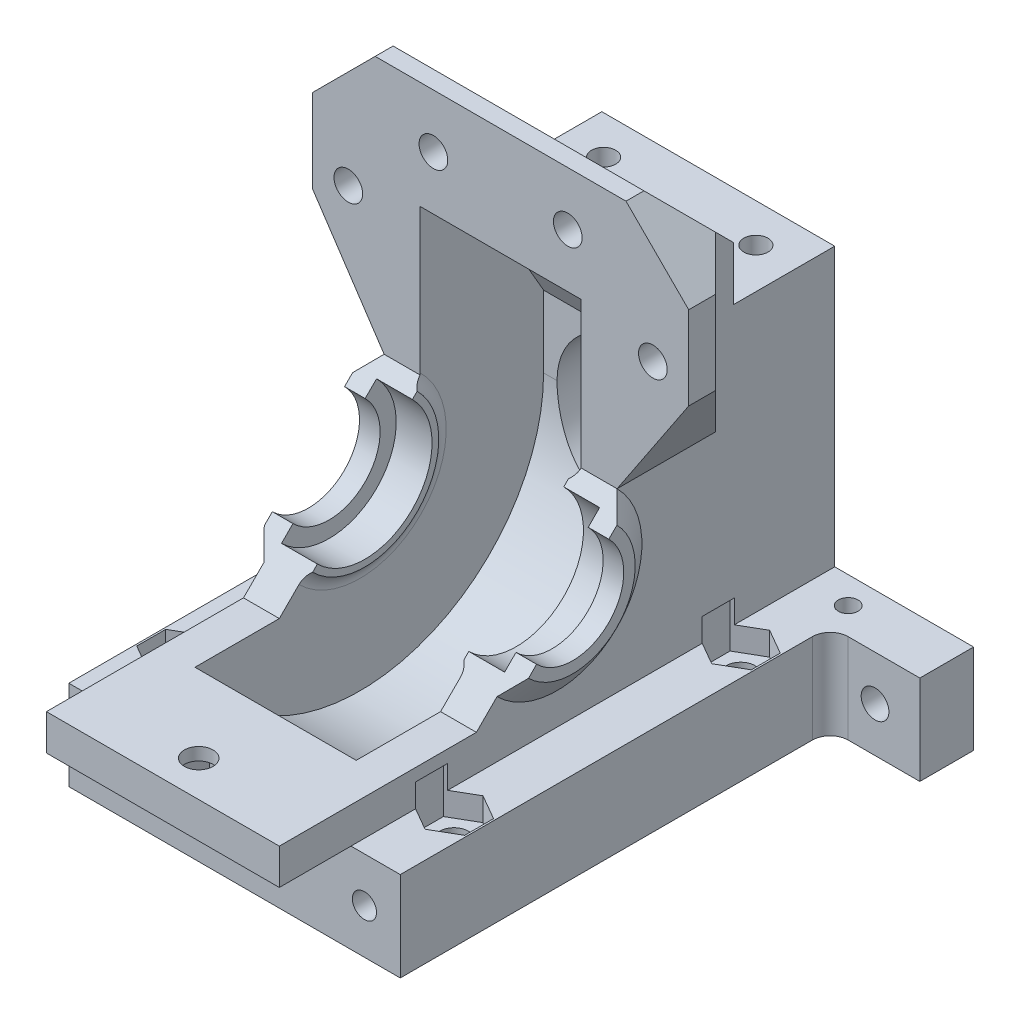
from build123d import *

# Parameters (mm, degrees)
ESQUISSE1_R                          = 1.1
ESQUISSE1_R_2                        = 1.6
BOSS_EXTRU_1_DEPTH                   = 10
BOSS_EXTRU_2_DEPTH                   = 13
BOSS_EXTRU_2_DEPTH_BACK              = 13
BOSS_EXTRU_3_DEPTH                   = 1.75
BOSS_EXTRU_7_DEPTH                   = 11
CHANFREIN2_SIZE                      = 8
ESQUISSE6_R                          = 1.6
ESQUISSE6_R_2                        = 1.55
ENL_V_MAT_EXTRU_3_DEPTH              = 52
ENL_V_MAT_EXTRU_17_DEPTH             = 21.3
ESQUISSE31_R                         = 1.35
ENL_V_MAT_EXTRU_16_DEPTH             = 10
ENL_V_MAT_EXTRU_5_DEPTH              = 2.6
ESQUISSE13_R                         = 1.35
ENL_V_MAT_EXTRU_6_DEPTH              = 8
ENL_V_MAT_EXTRU_7_DEPTH              = 9
ENL_V_MAT_EXTRU_7_DEPTH_BACK         = 9
BOSS_EXTRU_5_REACH                   = 61.593
ENL_V_MAT_EXTRU_8_DEPTH              = 4
CONG_1_R                             = 2
ENL_V_MAT_EXTRU_10_REACH             = 65.853
ESQUISSE21_R                         = 1.6
ENL_V_MAT_EXTRU_11_DEPTH             = 2.6
ESQUISSE30_R                         = 6
ESQUISSE30_R_2                       = 3.5
BOSS_EXTRU_6_DEPTH                   = 3.5
CONG_2_R                             = 3.5
ENL_V_MAT_EXTRU_12_REACH             = 78.689
ESQUISSE25_R                         = 5.1
ENL_V_MAT_EXTRU_12_DIRECTION_2_DEPTH = 2.5
ESQUISSE26_R                         = 7.5
ENL_V_MAT_EXTRU_13_DEPTH             = 5
ENL_V_MAT_EXTRU_13_DIRECTION_2_REACH = 70.48
CHANFREIN3_SIZE2                     = 2.5
CHANFREIN3_SIZE                      = 1.75
CHANFREIN4_SIZE2                     = 1.75
CHANFREIN4_SIZE                      = 2.5
CHANFREIN5_SIZE                      = 10


# Some blends are built 0.0001 mm under size
with BuildPart() as part:
    # Esquisse1 → Boss.-Extru.1 (new body)
    with BuildSketch(Plane(origin=(0, -23, 0), x_dir=(1, 0, 0), z_dir=(0, 1, 0))):
        Polygon((18.5, -23), (-18.5, -23), (-18.5, 25), (-28.5, 25), (-28.5, 31), (28.5, 31), (28.5, 25), (18.5, 25), align=None)
        with Locations(Location((-17.5, 28, 0), (0, 0, 270))):
            Circle(ESQUISSE1_R, mode=Mode.SUBTRACT)
        with Locations(Location((-15.5, 18, 0), (0, 0, 270))):
            Circle(ESQUISSE1_R_2, mode=Mode.SUBTRACT)
        with Locations(Location((-15.5, -14, 0), (0, 0, 270))):
            Circle(ESQUISSE1_R_2, mode=Mode.SUBTRACT)
        with Locations(Location((15.5, -14, 0), (0, 0, 90))):
            Circle(ESQUISSE1_R_2, mode=Mode.SUBTRACT)
        with Locations(Location((15.5, 18, 0), (0, 0, 90))):
            Circle(ESQUISSE1_R_2, mode=Mode.SUBTRACT)
        with Locations(Location((17.5, 28, 0), (0, 0, 90))):
            Circle(ESQUISSE1_R, mode=Mode.SUBTRACT)
    extrude(amount=BOSS_EXTRU_1_DEPTH)

    # Esquisse2 → Boss.-Extru.2 (add, two sides: drawn at the far end of the back side and taken through both)
    with BuildSketch(Plane(origin=(0, 0, 0), x_dir=(0, 0, -1), z_dir=(1, 0, 0)).offset(-BOSS_EXTRU_2_DEPTH_BACK)):
        with BuildLine():
            Line((31, -13), (-31, -13))
            Line((-31, -13), (-31, -9))
            Line((-31, -9), (-9, -9))
            Line((-9, -9), (-4.030508653, -4.030508653))
            ThreePointArc((-4.030508653, -4.030508653), (4.030508653, -4.030508653), (4.030508653, 4.030508653))
            Line((4.030508653, 4.030508653), (6.7, 6.7))
            Line((6.7, 6.7), (6.7, 35))
            Line((6.7, 35), (8.7, 35))
            Line((8.7, 35), (19.7, 24))
            Line((19.7, 24), (19.7, 18))
            Line((19.7, 18), (31, 18))
            Line((31, 18), (31, -13))
        make_face()
    extrude(amount=BOSS_EXTRU_2_DEPTH + BOSS_EXTRU_2_DEPTH_BACK)

    # Esquisse3 → Boss.-Extru.3 (add)
    with BuildSketch(Plane(origin=(13, 0, 0), x_dir=(0, 0, -1), z_dir=(1, 0, 0))):
        with BuildLine():
            Line((-6.7, -6.7), (-4.030508653, -4.030508653))
            ThreePointArc((-4.030508653, -4.030508653), (4.030508653, -4.030508653), (4.030508653, 4.030508653))
            Line((4.030508653, 4.030508653), (6.7, 6.7))
            ThreePointArc((6.7, 6.7), (6.7, -6.7), (-6.7, -6.7))
        make_face()
    boss_extru_3 = extrude(amount=BOSS_EXTRU_3_DEPTH)

    # Esquisse4 → Boss.-Extru.7 (add)
    with BuildSketch(Plane(origin=(19.7, 0, -6.7), x_dir=(-1, 0, 0), z_dir=(0, 0, -1))):
        Polygon((6.7, 6.7), (-1.3, 18.7), (-1.3, 26), (6.7, 26), align=None)
        Polygon((40.7, 18.7), (40.7, 26), (32.7, 26), (32.7, 6.7), align=None)
    extrude(amount=BOSS_EXTRU_7_DEPTH)

    # Chanfrein2
    chanfrein2_edges = [part.edges().sort_by_distance(p)[0] for p in [
        (-21, 22.35, -17.7),
        (21, 22.35, -17.7),
    ]]
    chamfer(chanfrein2_edges, length=CHANFREIN2_SIZE - 0.0001)  # a hair under: the kernel refuses the full size

    # Esquisse6 → Enlèv. mat.-Extru.3 (cut)
    with BuildSketch(Plane.XY.offset(23)):
        with Locations((17, 21)):
            Circle(ESQUISSE6_R)
        with Locations((7.5, 29)):
            Circle(ESQUISSE6_R)
        with Locations((23.5, -18)):
            Circle(ESQUISSE6_R_2)
    enl_v_mat_extru_3 = extrude(amount=-ENL_V_MAT_EXTRU_3_DEPTH, mode=Mode.SUBTRACT)

    # Esquisse7 → Enlèv. mat.-Extru.17 (cut)
    with BuildSketch(Plane(origin=(0, 0, -31), x_dir=(-1, 0, 0), z_dir=(0, 0, -1))):
        Polygon((-14.2, 22.616580754), (-17, 24.233161507), (-19.8, 22.616580754), (-19.8, 19.383419246), (-17, 17.766838493), (-14.2, 19.383419246), align=None)
        Polygon((-4.266838493, 29), (-5.883419246, 31.8), (-9.116580754, 31.8), (-10.733161507, 29), (-9.116580754, 26.2), (-5.883419246, 26.2), align=None)
    enl_v_mat_extru_17 = extrude(amount=-ENL_V_MAT_EXTRU_17_DEPTH, mode=Mode.SUBTRACT)

    # Esquisse31 → Enlèv. mat.-Extru.16 (cut)
    with BuildSketch(Plane.XY.offset(23)):
        with Locations((14.5, -18)):
            Circle(ESQUISSE31_R)
        with Locations(Location((-14.5, -18, 0), (0, 0, 280.628726743))):
            Circle(ESQUISSE31_R)
    enl_v_mat_extru_16 = extrude(amount=-ENL_V_MAT_EXTRU_16_DEPTH, mode=Mode.SUBTRACT)

    # Esquisse9 → Enlèv. mat.-Extru.5 (cut, symmetric)
    with BuildSketch(Plane(origin=(0, -13, 0), x_dir=(1, 0, 0), z_dir=(0, 1, 0))):
        Polygon((18.3, -15.616580754), (18.3, -12.383419246), (15.5, -10.766838493), (12.7, -12.383419246), (12.7, -15.616580754), (15.5, -17.233161507), align=None)
        Polygon((18.3, 19.616580754), (15.5, 21.233161507), (12.7, 19.616580754), (12.7, 16.383419246), (15.5, 14.766838493), (18.3, 16.383419246), align=None)
    enl_v_mat_extru_5 = extrude(amount=ENL_V_MAT_EXTRU_5_DEPTH, both=True, mode=Mode.SUBTRACT)

    # Esquisse13 → Enlèv. mat.-Extru.6 (cut)
    with BuildSketch(Plane(origin=(0, 18, 0), x_dir=(1, 0, 0), z_dir=(0, 1, 0))):
        with Locations(Location((8.5, 26.7, 0), (0, 0, 270))):
            Circle(ESQUISSE13_R)
    enl_v_mat_extru_6 = extrude(amount=-ENL_V_MAT_EXTRU_6_DEPTH, mode=Mode.SUBTRACT)

    # Esquisse14 → Enlèv. mat.-Extru.7 (cut, two sides: drawn at the far end of the back side and taken through both)
    with BuildSketch(Plane(origin=(0, 0, 0), x_dir=(0, 0, -1), z_dir=(1, 0, 0)).offset(-ENL_V_MAT_EXTRU_7_DEPTH_BACK)):
        with BuildLine():
            Line((20.5, 0), (20.5, 8))
            Line((20.5, 8), (13.57179677, 20))
            Line((13.57179677, 20), (6.7, 23))
            Line((6.7, 23), (6.7, 6.7))
            Line((6.7, 6.7), (4.030508653, 4.030508653))
            ThreePointArc((4.030508653, 4.030508653), (4.030508653, -4.030508653), (-4.030508653, -4.030508653))
            Line((-4.030508653, -4.030508653), (-9, -9))
            Line((-9, -9), (-18.418740456, -9))
            ThreePointArc((-18.418740456, -9), (4.618756361, -19.972908894), (20.5, 0))
        make_face()
    extrude(amount=ENL_V_MAT_EXTRU_7_DEPTH + ENL_V_MAT_EXTRU_7_DEPTH_BACK, mode=Mode.SUBTRACT)

    # Esquisse17 → Boss.-Extru.5 (add, up to next)
    with BuildSketch(Plane(origin=(8.45, 0, 0), x_dir=(0, 0, -1), z_dir=(1, 0, 0)), mode=Mode.PRIVATE) as boss_extru_5_sk1:
        with BuildLine():
            Line((4.030508653, 4.030508653), (5.833630945, 5.833630945))
            ThreePointArc((5.833630945, 5.833630945), (5.833630945, -5.833630945), (-5.833630945, -5.833630945))
            Line((-5.833630945, -5.833630945), (-4.030508653, -4.030508653))
            ThreePointArc((-4.030508653, -4.030508653), (4.030508653, -4.030508653), (4.030508653, 4.030508653))
        make_face()
    boss_extru_5_tool1 = extrude(boss_extru_5_sk1.sketch, amount=BOSS_EXTRU_5_REACH, mode=Mode.PRIVATE) - part.part
    boss_extru_5 = boss_extru_5_tool1.solids().sort_by_distance((8.45, -5.072906, 4.791233))[0]
    add(boss_extru_5)

    # Esquisse18 → Enlèv. mat.-Extru.8 (cut)
    with BuildSketch(Plane.ZY.offset(-8.45)):
        with BuildLine():
            Line((-5.303300859, 5.303300859), (5.303300859, -5.303300859))
            ThreePointArc((5.303300859, -5.303300859), (-5.303300859, -5.303300859), (-5.303300859, 5.303300859))
        make_face()
    enl_v_mat_extru_8 = extrude(amount=-ENL_V_MAT_EXTRU_8_DEPTH, mode=Mode.SUBTRACT)

    # Symétrie1: Boss.-Extru.3, Enlèv. mat.-Extru.3, Enlèv. mat.-Extru.17, Enlèv. mat.-Extru.16, Enlèv. mat.-Extru.5, Enlèv. mat.-Extru.6, Boss.-Extru.5, Enlèv. mat.-Extru.8 across plane
    add(boss_extru_3.mirror(Plane(origin=(0, 0, 0), x_dir=(0, 0, 1), z_dir=(1, 0, 0))))
    add(enl_v_mat_extru_3.mirror(Plane(origin=(0, 0, 0), x_dir=(0, 0, 1), z_dir=(1, 0, 0))), mode=Mode.SUBTRACT)
    add(enl_v_mat_extru_17.mirror(Plane(origin=(0, 0, 0), x_dir=(0, 0, 1), z_dir=(1, 0, 0))), mode=Mode.SUBTRACT)
    add(enl_v_mat_extru_16.mirror(Plane(origin=(0, 0, 0), x_dir=(0, 0, 1), z_dir=(1, 0, 0))), mode=Mode.SUBTRACT)
    add(enl_v_mat_extru_5.mirror(Plane(origin=(0, 0, 0), x_dir=(0, 0, 1), z_dir=(1, 0, 0))), mode=Mode.SUBTRACT)
    add(enl_v_mat_extru_6.mirror(Plane(origin=(0, 0, 0), x_dir=(0, 0, 1), z_dir=(1, 0, 0))), mode=Mode.SUBTRACT)
    add(boss_extru_5.mirror(Plane(origin=(0, 0, 0), x_dir=(0, 0, 1), z_dir=(1, 0, 0))))
    add(enl_v_mat_extru_8.mirror(Plane(origin=(0, 0, 0), x_dir=(0, 0, 1), z_dir=(1, 0, 0))), mode=Mode.SUBTRACT)

    # Congé1
    # the kernel refuses this fillet: 2 mm, written as the material it adds along each edge
    with BuildSketch(Plane(origin=(9, 0, 0), x_dir=(0, 0.7071067811865466, -0.7071067811865485), z_dir=(0, 0.7071067811865485, 0.7071067811865466))) as cong_1_piece_1:
        with BuildLine():
            CenterArc((9.627497731, 2), CONG_1_R, 226.468847833, 43.531152167)
            Line((8.25, 0.55), (8.25, 0))
            Line((8.25, 0), (9.627497731, 0))
        make_face()
    revolve(axis=Axis((9, 0, 0), (-1, 0, 0)), revolution_arc=180)
    with BuildSketch(Plane(origin=(9, 0, 0), x_dir=(0, 0.9332991182686485, -0.3590999245877991), z_dir=(0, 0.3590999245877991, 0.9332991182686485))) as cong_1_piece_2_section:
        with BuildLine():
            CenterArc((9.627497731, 2), CONG_1_R, 226.468847833, 43.531152167)
            Line((8.25, 0.55), (8.25, 0))
            Line((8.25, 0), (9.627497731, 0))
        make_face()
    cong_1_piece_2 = revolve(axis=Axis((9, 0, 0), (-1, 0, 0)), revolution_arc=227.910140794, mode=Mode.PRIVATE)
    cong_1_piece_2 = split(cong_1_piece_2, bisect_by=Plane(origin=(8.998948002, 6.806570833, -6.7), z_dir=(0, 0, -1)), keep=Keep.TOP, mode=Mode.PRIVATE)
    add(cong_1_piece_2)
    with BuildSketch(Plane(origin=(-9, 0, 0), x_dir=(0, 0.7071067811865466, -0.7071067811865485), z_dir=(0, 0.7071067811865485, 0.7071067811865466))) as cong_1_piece_3:
        with BuildLine():
            CenterArc((9.627497731, -2), CONG_1_R, 90, 43.531152167)
            Line((8.25, -0.55), (8.25, 0))
            Line((8.25, 0), (9.627497731, 0))
        make_face()
    revolve(axis=Axis((-9, 0, 0), (-1, 0, 0)), revolution_arc=180)
    with BuildSketch(Plane(origin=(-9, 0, 0), x_dir=(0, 0.9332991182686485, -0.3590999245877991), z_dir=(0, 0.3590999245877991, 0.9332991182686485))) as cong_1_piece_4_section:
        with BuildLine():
            CenterArc((9.627497731, -2), CONG_1_R, 90, 43.531152167)
            Line((8.25, -0.55), (8.25, 0))
            Line((8.25, 0), (9.627497731, 0))
        make_face()
    cong_1_piece_4 = revolve(axis=Axis((-9, 0, 0), (-1, 0, 0)), revolution_arc=227.910140794, mode=Mode.PRIVATE)
    cong_1_piece_4 = split(cong_1_piece_4, bisect_by=Plane(origin=(-8.998948002, 6.806570833, -6.7), z_dir=(0, 0, -1)), keep=Keep.TOP, mode=Mode.PRIVATE)
    add(cong_1_piece_4)
    with BuildSketch(Plane(origin=(18.5, -23, -25), x_dir=(1, 0, 0), z_dir=(0, 1, 0)), Plane(origin=(-18.5, -23, -25), x_dir=(0, 0, 1), z_dir=(0, 1, 0))) as cong_1_piece_5:
        with BuildLine():
            CenterArc((CONG_1_R, -CONG_1_R), CONG_1_R, 90, 90)
            Line((0, -CONG_1_R), (0, 0))
            Line((0, 0), (CONG_1_R, 0))
        make_face()
    extrude(amount=10)

    # Esquisse21 → Enlèv. mat.-Extru.10 (cut, up to next)
    with BuildSketch(Plane.XZ.offset(13), mode=Mode.PRIVATE) as enl_v_mat_extru_10_sk1:
        with Locations(Location((0, 27, 0), (0, 0, 270))):
            Circle(ESQUISSE21_R)
    enl_v_mat_extru_10_tool1 = extrude(enl_v_mat_extru_10_sk1.sketch, amount=-ENL_V_MAT_EXTRU_10_REACH, mode=Mode.PRIVATE) & part.part
    add(enl_v_mat_extru_10_tool1.solids().sort_by_distance((0, -13, 27))[0], mode=Mode.SUBTRACT)

    # Esquisse22 → Enlèv. mat.-Extru.11 (cut)
    with BuildSketch(Plane.XZ.offset(13)):
        Polygon((3.233161507, 27), (1.616580754, 29.8), (-1.616580754, 29.8), (-3.233161507, 27), (-1.616580754, 24.2), (1.616580754, 24.2), align=None)
    extrude(amount=-ENL_V_MAT_EXTRU_11_DEPTH, mode=Mode.SUBTRACT)

    # Esquisse30 → Boss.-Extru.6 (add)
    with BuildSketch(Plane(origin=(0, 0, -31), x_dir=(-1, 0, 0), z_dir=(0, 0, -1))):
        with Locations(Location((0, 0, 0), (0, 0, 180))):
            Circle(ESQUISSE30_R)
        Circle(ESQUISSE30_R_2, mode=Mode.SUBTRACT)
    extrude(amount=BOSS_EXTRU_6_DEPTH)

    # Congé2
    cong_2_edges = [part.edges().sort_by_distance(p)[0] for p in [
        (-6, 0, -31),
    ]]
    fillet(cong_2_edges, radius=CONG_2_R - 0.0001)  # a hair under: the kernel refuses the full size

    # Esquisse25 → Enlèv. mat.-Extru.12 (cut, up to next)
    with BuildSketch(Plane(origin=(0, 0, -31), x_dir=(-1, 0, 0), z_dir=(0, 0, -1)), mode=Mode.PRIVATE) as enl_v_mat_extru_12_sk1:
        Circle(ESQUISSE25_R)
    enl_v_mat_extru_12_tool1 = extrude(enl_v_mat_extru_12_sk1.sketch, amount=-ENL_V_MAT_EXTRU_12_REACH, mode=Mode.PRIVATE) & part.part
    add(enl_v_mat_extru_12_tool1.solids().sort_by_distance((0, 0, -31))[0], mode=Mode.SUBTRACT)

    # Esquisse25 → Enlèv. mat.-Extru.12 direction 2 (cut)
    with BuildSketch(Plane(origin=(0, 0, -31), x_dir=(-1, 0, 0), z_dir=(0, 0, -1))):
        Circle(ESQUISSE25_R)
    extrude(amount=ENL_V_MAT_EXTRU_12_DIRECTION_2_DEPTH, mode=Mode.SUBTRACT)

    # Esquisse26 → Enlèv. mat.-Extru.13 (cut)
    with BuildSketch(Plane.XY.offset(-20.5)):
        Circle(ESQUISSE26_R)
    extrude(amount=-ENL_V_MAT_EXTRU_13_DEPTH, mode=Mode.SUBTRACT)

    # Esquisse26 → Enlèv. mat.-Extru.13 direction 2 (cut, up to next)
    with BuildSketch(Plane.XY.offset(-20.5), mode=Mode.PRIVATE) as enl_v_mat_extru_13_direction_2_sk1:
        Circle(ESQUISSE26_R)
    enl_v_mat_extru_13_direction_2_tool1 = extrude(enl_v_mat_extru_13_direction_2_sk1.sketch, amount=ENL_V_MAT_EXTRU_13_DIRECTION_2_REACH, mode=Mode.PRIVATE) & part.part
    add(enl_v_mat_extru_13_direction_2_tool1.solids().sort_by_distance((0, 0, -20.5))[0], mode=Mode.SUBTRACT)

    # Chanfrein3
    chanfrein3_edges = [part.edges().sort_by_distance(p)[0] for p in [
        (14.75, -6.7, -6.7),
    ]]
    chanfrein3_side = [part.faces().sort_by_distance(p)[0] for p in [
        (14.715, -6.7, -6.7),
    ]]
    chamfer(chanfrein3_edges, length=CHANFREIN3_SIZE - 0.0001, length2=CHANFREIN3_SIZE2 - 0.0001, reference=chanfrein3_side[0])  # a hair under: the kernel refuses the full size

    # Chanfrein4
    chanfrein4_edges = [part.edges().sort_by_distance(p)[0] for p in [
        (-14.75, -6.7, -6.7),
    ]]
    chanfrein4_side = [part.faces().sort_by_distance(p)[0] for p in [
        (-14.75, -6.675251263, -6.675251263),
    ]]
    chamfer(chanfrein4_edges, length=CHANFREIN4_SIZE - 0.0001, length2=CHANFREIN4_SIZE2 - 0.0001, reference=chanfrein4_side[0])  # a hair under: the kernel refuses the full size

    # Chanfrein5
    # the kernel refuses this chamfer: 10 mm, written as the material it adds along each edge
    with BuildSketch(Plane(origin=(13, 26, -6.7), x_dir=(-0.027495876610586317, 0.9996219169112968, 0), z_dir=(0, 0, -1))) as chanfrein5_piece_1_section:
        Polygon((CHANFREIN5_SIZE * 0.999621916911, CHANFREIN5_SIZE * 0.0274958766106), (-CHANFREIN5_SIZE * 0.0274958766106, CHANFREIN5_SIZE * 0.999621916911), (0, 0), align=None)
    chanfrein5_piece_1 = extrude(amount=36.71682988, mode=Mode.PRIVATE)
    chanfrein5_piece_1 = split(chanfrein5_piece_1, bisect_by=Plane(origin=(15.905078953, 35, -10.088110042), z_dir=(0, -1, 0)), keep=Keep.TOP, mode=Mode.PRIVATE)
    chanfrein5_piece_1 = split(chanfrein5_piece_1, bisect_by=Plane(origin=(21, 29.004234715, -10.088110042), z_dir=(-1, 0, 0)), keep=Keep.TOP, mode=Mode.PRIVATE)
    chanfrein5_piece_1 = split(chanfrein5_piece_1, bisect_by=Plane(origin=(15.905078953, 31.308062337, -12.391937663), z_dir=(0, -0.7071067811865492, 0.707106781186546)), keep=Keep.TOP, mode=Mode.PRIVATE)
    chanfrein5_piece_1 = split(chanfrein5_piece_1, bisect_by=Plane(origin=(18.258534456, 29.004234715, -12.441565544), z_dir=(-0.7071067811865476, 0, 0.7071067811865476)), keep=Keep.TOP, mode=Mode.PRIVATE)
    add(chanfrein5_piece_1)
    with BuildSketch(Plane(origin=(-13, 26, -6.7), x_dir=(-0.9996219169112968, -0.027495876610586317, 0), z_dir=(0, 0, -1))) as chanfrein5_piece_2_section:
        Polygon((CHANFREIN5_SIZE * 0.999621916911, CHANFREIN5_SIZE * 0.0274958766106), (-CHANFREIN5_SIZE * 0.0274958766106, CHANFREIN5_SIZE * 0.999621916911), (0, 0), align=None)
    chanfrein5_piece_2 = extrude(amount=36.71682988, mode=Mode.PRIVATE)
    chanfrein5_piece_2 = split(chanfrein5_piece_2, bisect_by=Plane(origin=(-21, 29.004234715, -10.088110042), z_dir=(1, 0, 0)), keep=Keep.TOP, mode=Mode.PRIVATE)
    chanfrein5_piece_2 = split(chanfrein5_piece_2, bisect_by=Plane(origin=(-15.905078953, 35, -10.088110042), z_dir=(0, -1, 0)), keep=Keep.TOP, mode=Mode.PRIVATE)
    chanfrein5_piece_2 = split(chanfrein5_piece_2, bisect_by=Plane(origin=(-15.905078953, 31.308062337, -12.391937663), z_dir=(0, -0.7071067811865492, 0.707106781186546)), keep=Keep.TOP, mode=Mode.PRIVATE)
    chanfrein5_piece_2 = split(chanfrein5_piece_2, bisect_by=Plane(origin=(-18.258534456, 29.004234715, -12.441565544), z_dir=(0.7071067811865476, 0, 0.7071067811865476)), keep=Keep.TOP, mode=Mode.PRIVATE)
    add(chanfrein5_piece_2)


solid = part.part
